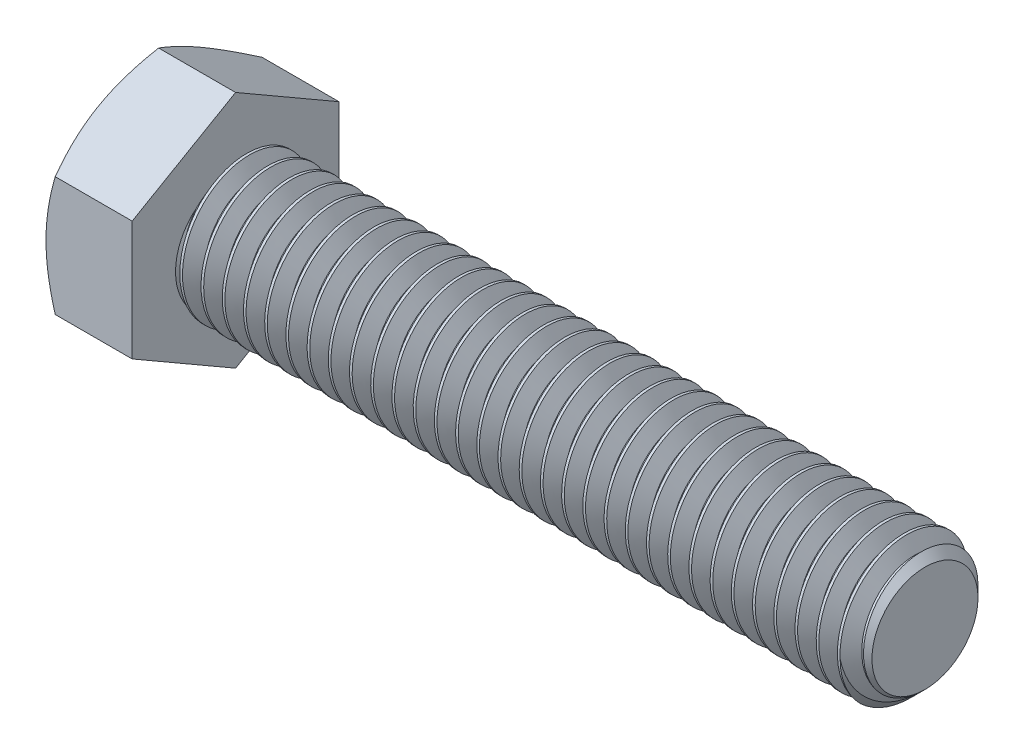
from build123d import *

# Parameters (mm, degrees)
SKETCH5_R           = 6.35
BOSS_EXTRUDE3_DEPTH = 63.5
CHAMFER1_SIZE       = 1.465384615
CUT_SWEEP1_PITCH    = 1.953846154
BOSS_EXTRUDE4_DEPTH = 7.9375
SKETCH8_OUTSIDE_W   = 292.488
SKETCH8_OUTSIDE_H   = 295.436
SKETCH8_OUTSIDE_R   = 9.525
CUT_EXTRUDE3_DEPTH  = 73.904112021
CUT_EXTRUDE3_DRAFT  = -60


with BuildPart() as part:
    # Sketch5 → Boss-Extrude3 (new body)
    with BuildSketch(Plane(origin=(35.71875, 0, 0), x_dir=(0, 0, -1), z_dir=(1, 0, 0))):
        Circle(SKETCH5_R)
    extrude(amount=-BOSS_EXTRUDE3_DEPTH)

    # Chamfer1
    chamfer1_edges = [part.edges().sort_by_distance(p)[0] for p in [
        (35.71875, 0, 6.35),
    ]]
    chamfer(chamfer1_edges, length=CHAMFER1_SIZE)

    # Cut-Sweep1: arcs per turn and ends read off the stored shape
    # Cut-Sweep1: the profile of Sketch10 profile screwed along a right-hand helix through 33.5 turns, 10 arcs to a turn; built about Z, then put on its axis
    cut_sweep1_z = Axis((0, 0, 0), (0, 0, 1))
    cut_sweep1_corners = [(6.3503, 0, 0.000173205), (5.080939697, 0, -0.732692308), (5.080939697, 0, -0.976923077), (6.3503, 0, -1.70978859)]
    with BuildLine(mode=Mode.PRIVATE) as cut_sweep1_profile:
        Line(cut_sweep1_corners[0], cut_sweep1_corners[1])
        Line(cut_sweep1_corners[1], cut_sweep1_corners[2])
        Line(cut_sweep1_corners[2], cut_sweep1_corners[3])
        Line(cut_sweep1_corners[3], cut_sweep1_corners[0])
    cut_sweep1_cap = Face(cut_sweep1_profile.wire())
    cut_sweep1_turn_angles = [0, 18, 36, 54, 72, 90, 108, 126, 144, 162, 180, 198, 216, 234, 252, 270, 288, 306, 324, 342, 360]
    cut_sweep1_turn_weights = [1, 0.9510565162951535, 1, 0.9510565162951535, 1, 0.9510565162951535, 1, 0.9510565162951535, 1, 0.9510565162951535, 1, 0.9510565162951535, 1, 0.9510565162951535, 1, 0.9510565162951535, 1, 0.9510565162951535, 1, 0.9510565162951535, 1]
    cut_sweep1_turn_rails = [Edge.make_bspline([Vector(p[0], p[1], 0).rotate(cut_sweep1_z, cut_sweep1_turn_angles[k]) / cut_sweep1_turn_weights[k] + Vector(0, 0, p[2] + CUT_SWEEP1_PITCH * cut_sweep1_turn_angles[k] / 360) for k in range(21)], [0, 0, 0, 1, 1, 2, 2, 3, 3, 4, 4, 5, 5, 6, 6, 7, 7, 8, 8, 9, 9, 10, 10, 10], 2, cut_sweep1_turn_weights) for p in cut_sweep1_corners]
    cut_sweep1_turn_sides = [Face.make_surface_from_curves(cut_sweep1_turn_rails[p[0]], cut_sweep1_turn_rails[p[1]]) for p in [(0, 1), (1, 2), (2, 3), (3, 0)]]
    cut_sweep1_last_angles = [11880, 11898, 11916, 11934, 11952, 11970, 11988, 12006, 12024, 12042, 12060]
    cut_sweep1_last_weights = [1, 0.9510565162951535, 1, 0.9510565162951535, 1, 0.9510565162951535, 1, 0.9510565162951535, 1, 0.9510565162950506, 1]
    cut_sweep1_last_rails = [Edge.make_bspline([Vector(p[0], p[1], 0).rotate(cut_sweep1_z, cut_sweep1_last_angles[k]) / cut_sweep1_last_weights[k] + Vector(0, 0, p[2] + CUT_SWEEP1_PITCH * cut_sweep1_last_angles[k] / 360) for k in range(11)], [0, 0, 0, 1, 1, 2, 2, 3, 3, 4, 4, 5, 5, 5], 2, cut_sweep1_last_weights) for p in cut_sweep1_corners]
    cut_sweep1_last_sides = [Face.make_surface_from_curves(cut_sweep1_last_rails[p[0]], cut_sweep1_last_rails[p[1]]) for p in [(0, 1), (1, 2), (2, 3), (3, 0)]]
    cut_sweep1 = Plane(origin=(35.71875, 0, 0), x_dir=(0, 1, 0), z_dir=(-1, 0, 0)) * Solid(Shell([*[p.moved(Location((0, 0, CUT_SWEEP1_PITCH * i))) for i in range(33) for p in cut_sweep1_turn_sides], *cut_sweep1_last_sides, cut_sweep1_cap, cut_sweep1_cap.rotate(cut_sweep1_z, 12060).moved(Location((0, 0, CUT_SWEEP1_PITCH * 12060 / 360)))]))
    add(cut_sweep1, mode=Mode.SUBTRACT)

    # Sketch6 → Boss-Extrude4 (add)
    with BuildSketch(Plane.ZY.offset(27.78125)):
        Polygon((9.525, 5.499261314), (0, 10.998522628), (-9.525, 5.499261314), (-9.525, -5.499261314), (0, -10.998522628), (9.525, -5.499261314), align=None)
    extrude(amount=BOSS_EXTRUDE4_DEPTH)


with BuildPart() as cut_extrude3_tool:
    # Sketch8 outside → Cut-Extrude3 (with draft: the straight prism first)
    with BuildSketch(Plane.ZY.offset(35.71875)):
        Rectangle(SKETCH8_OUTSIDE_W, SKETCH8_OUTSIDE_H)
        Circle(SKETCH8_OUTSIDE_R, mode=Mode.SUBTRACT)
    extrude(amount=-CUT_EXTRUDE3_DEPTH)
    # Cut-Extrude3: the draft: its side faces are tilted about the plane it starts from
    cut_extrude3_sides = [cut_extrude3_tool.faces().sort_by_distance(p)[0] for p in [
        (1.233306011, -147.718, 0),
        (1.233306011, 0, 146.244),
        (1.233306011, 147.718, 0),
        (1.233306011, 0, -146.244),
        (1.233306011, 0, -9.525),
    ]]
    draft(cut_extrude3_sides, Plane.ZY.offset(35.71875), CUT_EXTRUDE3_DRAFT)


with BuildPart() as part_1:
    add(part.part)

    # Cut-Extrude3: cut by cut_extrude3_tool
    add(cut_extrude3_tool.part, mode=Mode.SUBTRACT)


solid = part_1.part
